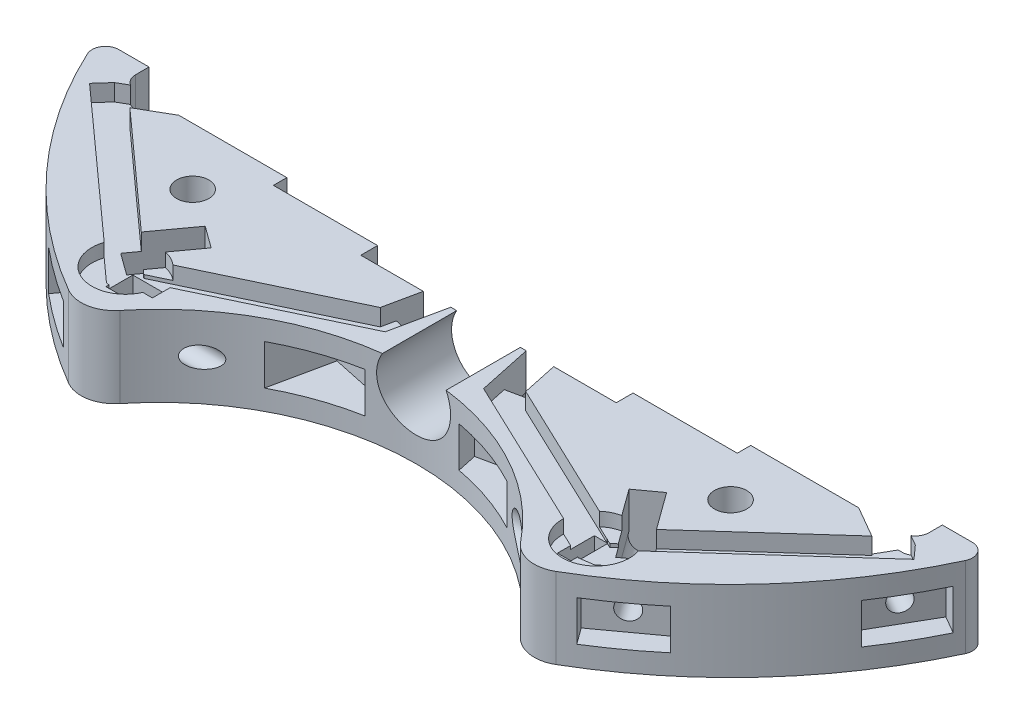
from build123d import *

# Parameters (mm, degrees)
BOSS_EXTRUDE1_DEPTH  = 6
SOLENOID_PLACEMENT_W = 38
SOLENOID_PLACEMENT_H = 64
CUT_EXTRUDE1_DEPTH   = 103.528044944
SKETCH6_R            = 2.4
CUT_EXTRUDE6_DEPTH   = 103.528044944
CUT_EXTRUDE3_DEPTH   = 103.528044944
FILLET1_R            = 2
CUT_EXTRUDE7_DEPTH   = 3
SKETCH11_R           = 5.5
CUT_EXTRUDE8_DEPTH   = 72.045194842
SKETCH12_W           = 69
SKETCH12_H           = 67
CUT_EXTRUDE9_DEPTH   = 92.588236181
SKETCH13_R           = 5
CUT_EXTRUDE10_DEPTH  = 2
CUT_EXTRUDE11_DEPTH  = 3
SKETCH15_R           = 1.55
CUT_EXTRUDE12_DEPTH  = 4.2
SKETCH16_R           = 2.1
CUT_EXTRUDE13_DEPTH  = 9
SKETCH17_W           = 4
SKETCH17_H           = 7.915077416
CUT_EXTRUDE14_DEPTH  = 9
CIRPATTERN1_COUNT    = 6
CIRPATTERN1_ANGLE    = 120
SKETCH18_R           = 1.55
CUT_EXTRUDE15_DEPTH  = 4.2
SKETCH19_R           = 2.1
CUT_EXTRUDE16_DEPTH  = 9
SKETCH20_W           = 4
SKETCH20_H           = 10.352031522
CUT_EXTRUDE17_DEPTH  = 9
CIRPATTERN2_COUNT    = 2
CIRPATTERN2_ANGLE    = 24
CUT_EXTRUDE19_DEPTH  = 2.5
SKETCH22_R           = 1.55
CUT_EXTRUDE20_DEPTH  = 29
CUT_EXTRUDE21_DEPTH  = 6.9
SKETCH24_R           = 2.75
CUT_EXTRUDE23_DEPTH  = 30
SKETCH25_W           = 5.5
SKETCH25_H           = 1
CUT_EXTRUDE24_DEPTH  = 4
SKETCH26_W           = 2
SKETCH26_H           = 5.5
CUT_EXTRUDE25_DEPTH  = 92.031066156


with BuildPart() as part:
    # Sketch1 → Boss-Extrude1 (new, symmetric)
    with BuildSketch(Plane(origin=(0, 0, 0), x_dir=(1, 0, 0), z_dir=(0, 1, 0))):
        with BuildLine():
            ThreePointArc((36.224522061, -62.223661106), (0, 72), (-36.224522061, -62.223661106))
            ThreePointArc((-36.224522061, -62.223661106), (-32.797800029, -62.818856853), (-29.811944095, -61.035223988))
            ThreePointArc((-29.811944095, -61.035223988), (0, -46.75), (29.811944095, -61.035223988))
            ThreePointArc((29.811944095, -61.035223988), (32.797800029, -62.818856853), (36.224522061, -62.223661106))
        make_face()
    extrude(amount=BOSS_EXTRUDE1_DEPTH, both=True)

    # solenoid placement → Cut-Extrude1 (cut, through all)
    with BuildSketch(Plane(origin=(0, 6, 0), x_dir=(1, 0, 0), z_dir=(0, 1, 0))):
        with Locations((0, -4)):
            Rectangle(SOLENOID_PLACEMENT_W, SOLENOID_PLACEMENT_H)
    extrude(amount=-CUT_EXTRUDE1_DEPTH, mode=Mode.SUBTRACT)

    # Sketch6 → Cut-Extrude6 (cut, through all)
    with BuildSketch(Plane(origin=(0, 6, 0), x_dir=(1, 0, 0), z_dir=(0, 1, 0))):
        with Locations((40, -40)):
            Circle(SKETCH6_R)
        with Locations((-40, -40)):
            Circle(SKETCH6_R)
    extrude(amount=-CUT_EXTRUDE6_DEPTH, mode=Mode.SUBTRACT)

    # Sketch3 → Cut-Extrude3 (cut, through all)
    with BuildSketch(Plane(origin=(0, 6, 0), x_dir=(1, 0, 0), z_dir=(0, 1, 0))):
        Polygon((-72, -27.5), (-59, -27.5), (-59, -31.5), (59, -31.5), (59, -27.5), (72, -27.5), (72, 31.5), (72, 72), (-72, 72), (-72, 31.5), align=None)
    extrude(amount=-CUT_EXTRUDE3_DEPTH, mode=Mode.SUBTRACT)

    # Fillet1
    fillet1_edges = [part.edges().sort_by_distance(p)[0] for p in [
        (66.541340534, 0, 27.5),
        (59, 0, 31.5),
        (-66.541340534, 0, 27.5),
        (-59, 0, 31.5),
    ]]
    fillet(fillet1_edges, radius=FILLET1_R)

    # Sketch9 → Cut-Extrude7 (cut, symmetric)
    with BuildSketch(Plane(origin=(0, 0, 0), x_dir=(1, 0, 0), z_dir=(0, 1, 0))):
        with BuildLine():
            Line((-64.703295733, -31.582962517), (-62.105219521, -30.082962517))
            Line((-62.105219521, -30.082962517), (-57.105219521, -38.743216555))
            Line((-57.105219521, -38.743216555), (-59.703295733, -40.243216555))
            ThreePointArc((-59.703295733, -40.243216555), (-62.353829072, -36), (-64.703295733, -31.582962517))
        make_face()
        with BuildLine():
            Line((-46.263453759, -55.169673248), (-44.500098002, -52.742622265))
            Line((-44.500098002, -52.742622265), (-36.409928058, -58.620474788))
            Line((-36.409928058, -58.620474788), (-38.173283815, -61.047525771))
            ThreePointArc((-38.173283815, -61.047525771), (-42.320538165, -58.249223595), (-46.263453759, -55.169673248))
        make_face()
        with BuildLine():
            Line((38.173283815, -61.047525771), (36.409928058, -58.620474788))
            Line((36.409928058, -58.620474788), (44.500098002, -52.742622265))
            Line((44.500098002, -52.742622265), (46.263453759, -55.169673248))
            ThreePointArc((46.263453759, -55.169673248), (42.320538165, -58.249223595), (38.173283815, -61.047525771))
        make_face()
        with BuildLine():
            Line((59.703295733, -40.243216555), (57.105219521, -38.743216555))
            Line((57.105219521, -38.743216555), (62.105219521, -30.082962517))
            Line((62.105219521, -30.082962517), (64.703295733, -31.582962517))
            ThreePointArc((64.703295733, -31.582962517), (62.353829072, -36), (59.703295733, -40.243216555))
        make_face()
    extrude(amount=CUT_EXTRUDE7_DEPTH, both=True, mode=Mode.SUBTRACT)

    # Sketch11 → Cut-Extrude8 (cut, through all)
    with BuildSketch(Plane(origin=(0, 0, 36), x_dir=(-1, 0, 0), z_dir=(0, 0, -1))):
        with Locations((0, 3.2)):
            Circle(SKETCH11_R)
    extrude(amount=-CUT_EXTRUDE8_DEPTH, mode=Mode.SUBTRACT)

    # Sketch12 → Cut-Extrude9 (cut, through all)
    with BuildSketch(Plane(origin=(0, 6, 0), x_dir=(1, 0, 0), z_dir=(0, 1, 0))):
        Rectangle(SKETCH12_W, SKETCH12_H)
    extrude(amount=-CUT_EXTRUDE9_DEPTH, mode=Mode.SUBTRACT)

    # Sketch13 → Cut-Extrude10 (cut)
    with BuildSketch(Plane(origin=(0, 6, 0), x_dir=(1, 0, 0), z_dir=(0, 1, 0))):
        with Locations((-35, -55)):
            Circle(SKETCH13_R)
        with Locations((35, -55)):
            Circle(SKETCH13_R)
    extrude(amount=-CUT_EXTRUDE10_DEPTH, mode=Mode.SUBTRACT)

    # Sketch14 → Cut-Extrude11 (cut, symmetric)
    with BuildSketch(Plane(origin=(0, 0, 0), x_dir=(1, 0, 0), z_dir=(0, 1, 0))):
        Polygon((16.165346281, -42.383834432), (6.383870274, -44.46295134), (7.007605346, -47.397394142), (8.274827543, -53.359205845), (18.056303551, -51.280088937), (16.789081354, -45.318277234), align=None)
        Polygon((-18.056303551, -51.280088937), (-8.274827543, -53.359205845), (-7.007605346, -47.397394142), (-6.383870274, -44.46295134), (-16.165346281, -42.383834432), (-16.789081354, -45.318277234), align=None)
    extrude(amount=CUT_EXTRUDE11_DEPTH, both=True, mode=Mode.SUBTRACT)

    # Sketch15 → Cut-Extrude12 (cut)
    with BuildSketch(Plane(origin=(59.605219521, 0, 34.413089536), x_dir=(0.49999999999999856, 0, -0.8660254037844396), z_dir=(0.8660254037844396, 0, 0.49999999999999856))):
        Circle(SKETCH15_R)
    cut_extrude12 = extrude(amount=-CUT_EXTRUDE12_DEPTH, mode=Mode.SUBTRACT)

    # Sketch16 → Cut-Extrude13 (cut)
    with BuildSketch(Plane(origin=(55.967912825, 0, 32.313089536), x_dir=(0.49999999999999856, 0, -0.8660254037844395), z_dir=(0.8660254037844395, 0, 0.49999999999999856))):
        Circle(SKETCH16_R)
    cut_extrude13 = extrude(amount=-CUT_EXTRUDE13_DEPTH, mode=Mode.SUBTRACT)

    # Sketch17 → Cut-Extrude14 (cut)
    with BuildSketch(Plane(origin=(55.967912825, 0, 32.313089536), x_dir=(-0.4999999999999985, 0, 0.8660254037844395), z_dir=(-0.8660254037844395, 0, -0.4999999999999985))):
        with Locations((0, 3.957538708)):
            Rectangle(SKETCH17_W, SKETCH17_H)
    cut_extrude14 = extrude(amount=CUT_EXTRUDE14_DEPTH, mode=Mode.SUBTRACT)

    # CirPattern1: Cut-Extrude12, Cut-Extrude13, Cut-Extrude14 ×6 about axis
    cirpattern1_axis = Axis((0, 6, 0), (0, -1, 0))
    add([cut_extrude12.rotate(cirpattern1_axis, i * CIRPATTERN1_ANGLE / (CIRPATTERN1_COUNT - 1)) for i in range(1, CIRPATTERN1_COUNT)], mode=Mode.SUBTRACT)
    add([cut_extrude13.rotate(cirpattern1_axis, i * CIRPATTERN1_ANGLE / (CIRPATTERN1_COUNT - 1)) for i in range(1, CIRPATTERN1_COUNT)], mode=Mode.SUBTRACT)
    add([cut_extrude14.rotate(cirpattern1_axis, i * CIRPATTERN1_ANGLE / (CIRPATTERN1_COUNT - 1)) for i in range(1, CIRPATTERN1_COUNT)], mode=Mode.SUBTRACT)

    # Sketch18 → Cut-Extrude15 (cut)
    with BuildSketch(Plane(origin=(9.318313076, 0, 43.839216267), x_dir=(0.9781476007338058, 0, -0.2079116908177589), z_dir=(0.2079116908177589, 0, 0.9781476007338058))):
        Circle(SKETCH18_R)
    cut_extrude15 = extrude(amount=-CUT_EXTRUDE15_DEPTH, mode=Mode.SUBTRACT)

    # Sketch19 → Cut-Extrude16 (cut)
    with BuildSketch(Plane(origin=(8.445083975, 0, 39.730996344), x_dir=(0.9781476007338058, 0, -0.20791169081775893), z_dir=(0.20791169081775893, 0, 0.9781476007338058))):
        Circle(SKETCH19_R)
    cut_extrude16 = extrude(amount=-CUT_EXTRUDE16_DEPTH, mode=Mode.SUBTRACT)

    # Sketch20 → Cut-Extrude17 (cut)
    with BuildSketch(Plane(origin=(8.445083975, 0, 39.730996344), x_dir=(-0.9781476007338058, 0, 0.20791169081775895), z_dir=(-0.20791169081775895, 0, -0.9781476007338058))):
        with Locations((0, 5.176015761)):
            Rectangle(SKETCH20_W, SKETCH20_H)
    cut_extrude17 = extrude(amount=CUT_EXTRUDE17_DEPTH, mode=Mode.SUBTRACT)

    # CirPattern2: Cut-Extrude15, Cut-Extrude16, Cut-Extrude17 ×2 about axis
    cirpattern2_axis = Axis((0, 6, 0), (0, -1, 0))
    add([cut_extrude15.rotate(cirpattern2_axis, i * CIRPATTERN2_ANGLE / (CIRPATTERN2_COUNT - 1)) for i in range(1, CIRPATTERN2_COUNT)], mode=Mode.SUBTRACT)
    add([cut_extrude16.rotate(cirpattern2_axis, i * CIRPATTERN2_ANGLE / (CIRPATTERN2_COUNT - 1)) for i in range(1, CIRPATTERN2_COUNT)], mode=Mode.SUBTRACT)
    add([cut_extrude17.rotate(cirpattern2_axis, i * CIRPATTERN2_ANGLE / (CIRPATTERN2_COUNT - 1)) for i in range(1, CIRPATTERN2_COUNT)], mode=Mode.SUBTRACT)

    # Sketch21 → Cut-Extrude19 (cut)
    with BuildSketch(Plane(origin=(0, 6, 0), x_dir=(1, 0, 0), z_dir=(0, 1, 0))):
        Polygon((10.401379176, -39.315172963), (6.488788773, -40.146819726), (7.112523846, -43.081262528), (7.317861369, -44.047299621), (34.140906227, -56.806089114), (36.337145446, -56.487293534), (61.317289385, -34.028992625), (59.565989037, -32.081038728), (56.967912825, -30.581038728), (54.967912825, -34.045140343), (55.180143528, -34.167671797), (34.654677472, -52.621011943), (10.819776726, -41.283578672), align=None)
        Polygon((-36.337145446, -56.487293534), (-34.140906227, -56.806089114), (-7.317861369, -44.047299621), (-7.112523846, -43.081262528), (-6.488788773, -40.146819726), (-10.401379176, -39.315172963), (-10.819776726, -41.283578672), (-34.654677472, -52.621011943), (-55.180143528, -34.167671797), (-54.967912825, -34.045140343), (-56.967912825, -30.581038728), (-59.565989037, -32.081038728), (-61.317289385, -34.028992625), align=None)
    extrude(amount=-CUT_EXTRUDE19_DEPTH, mode=Mode.SUBTRACT)

    # Sketch22 → Cut-Extrude20 (cut)
    with BuildSketch(Plane(origin=(0, 0, 0), x_dir=(0, 0, -1), z_dir=(1, 0, 0))):
        with Locations((-55, 0)):
            Circle(SKETCH22_R)
    extrude(amount=-CUT_EXTRUDE20_DEPTH, mode=Mode.SUBTRACT)

    # Sketch23 → Cut-Extrude21 (cut)
    with BuildSketch(Plane(origin=(-29, 0, 0), x_dir=(0, 0, -1), z_dir=(1, 0, 0))):
        with BuildLine():
            Line((-57, 8.792594458), (-53, 8.792594458))
            Line((-53, 8.792594458), (-53, 0.640312424))
            ThreePointArc((-53, 0.640312424), (-55, -2.1), (-57, 0.640312424))
            Line((-57, 0.640312424), (-57, 8.792594458))
        make_face()
    extrude(amount=-CUT_EXTRUDE21_DEPTH, mode=Mode.SUBTRACT)

    # Sketch24 → Cut-Extrude23 (cut)
    with BuildSketch(Plane(origin=(0, 0, 0), x_dir=(0, 0, -1), z_dir=(1, 0, 0))):
        with Locations((-55, 0)):
            Circle(SKETCH24_R)
    extrude(amount=CUT_EXTRUDE23_DEPTH, mode=Mode.SUBTRACT)

    # Sketch25 → Cut-Extrude24 (cut)
    with BuildSketch(Plane.ZY.offset(-30)):
        with Locations((55, 0)):
            Rectangle(SKETCH25_W, SKETCH25_H)
    extrude(amount=-CUT_EXTRUDE24_DEPTH, mode=Mode.SUBTRACT)

    # Sketch26 → Cut-Extrude25 (cut, through all)
    with BuildSketch(Plane.XZ.offset(-0.5)):
        with Locations((33, 55)):
            Rectangle(SKETCH26_W, SKETCH26_H)
    extrude(amount=-CUT_EXTRUDE25_DEPTH, mode=Mode.SUBTRACT)


solid = part.part
